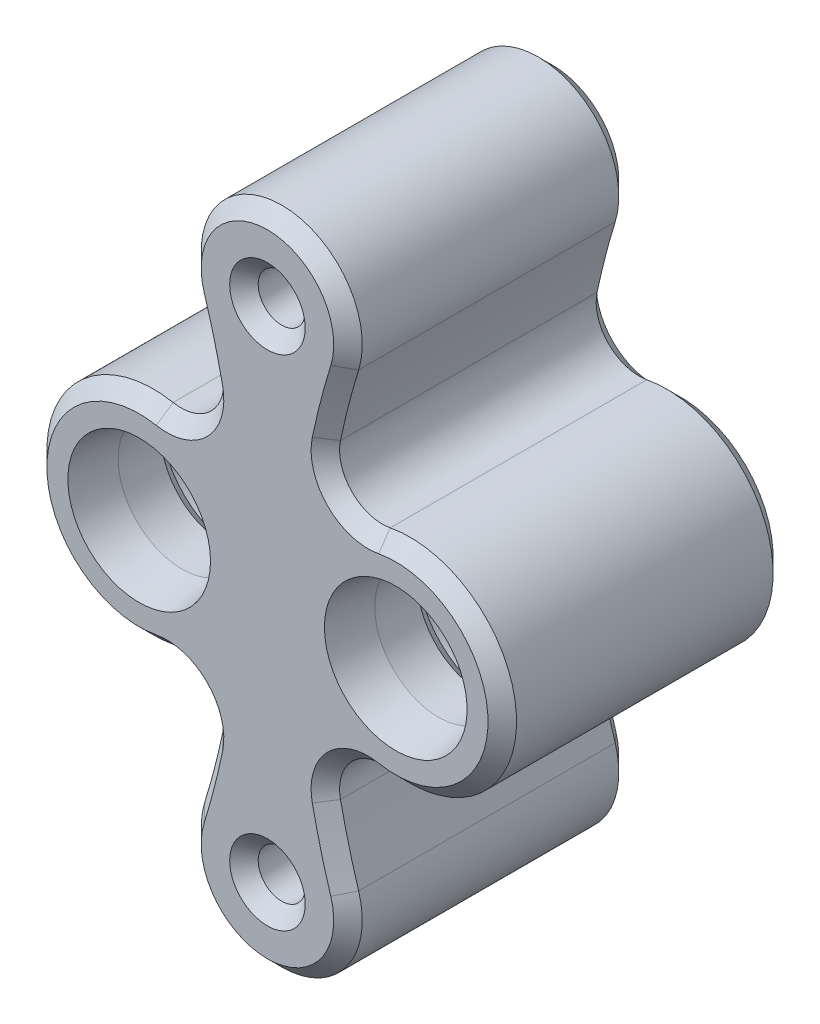
from build123d import *
from OCP.BRepFilletAPI import BRepFilletAPI_MakeChamfer

# Parameters (mm, degrees)
SKETCH1_R               = 1.65
SKETCH1_R_2             = 4.475
BOSS_EXTRUDE1_DEPTH     = 20
CHAMFER1_SIZE           = 1
CHAMFER2_SIZE           = 3
CHAMFER2_SIZE2          = 0.528980942
CUT_EXTRUDE1_DEPTH      = 3
CUT_EXTRUDE1_DEPTH_BACK = 3
SKETCH5_R               = 5.475
CHAMFER3_SIZE           = 1


with BuildPart() as part:
    # Sketch1 → Boss-Extrude1 (new body)
    with BuildSketch(Plane.XY):
        with BuildLine():
            ThreePointArc((5.396692576, -1.672784876), (0, 5.65), (-5.396692576, -1.672784876))
            ThreePointArc((-5.396692576, -1.672784876), (-4.701973782, -4.118237099), (-4.124302136, -6.593952399))
            ThreePointArc((-4.124302136, -6.593952399), (-4.919523181, -9.306745557), (-7.616470373, -10.154152821))
            ThreePointArc((-7.616470373, -10.154152821), (-16.475, -17.5), (-7.616470373, -24.845847179))
            ThreePointArc((-7.616470373, -24.845847179), (-4.919523181, -25.693254443), (-4.124302136, -28.406047601))
            ThreePointArc((-4.124302136, -28.406047601), (-4.701973782, -30.881762901), (-5.396692576, -33.327215124))
            ThreePointArc((-5.396692576, -33.327215124), (0, -40.65), (5.396692576, -33.327215124))
            ThreePointArc((5.396692576, -33.327215124), (4.701973782, -30.881762901), (4.124302136, -28.406047601))
            ThreePointArc((4.124302136, -28.406047601), (4.919523181, -25.693254443), (7.616470373, -24.845847179))
            ThreePointArc((7.616470373, -24.845847179), (16.475, -17.5), (7.616470373, -10.154152821))
            ThreePointArc((7.616470373, -10.154152821), (4.919523181, -9.306745557), (4.124302136, -6.593952399))
            ThreePointArc((4.124302136, -6.593952399), (4.701973782, -4.118237099), (5.396692576, -1.672784876))
        make_face()
        Circle(SKETCH1_R, mode=Mode.SUBTRACT)
        with Locations((0, -35)):
            Circle(SKETCH1_R, mode=Mode.SUBTRACT)
        with Locations((9, -17.5)):
            Circle(SKETCH1_R_2, mode=Mode.SUBTRACT)
        with Locations((-9, -17.5)):
            Circle(SKETCH1_R_2, mode=Mode.SUBTRACT)
    extrude(amount=BOSS_EXTRUDE1_DEPTH)

    # Chamfer1
    chamfer1_edges = [part.edges().sort_by_distance(p)[0] for p in [
        (0, -40.65, 0),
        (-4.701973782, -30.881762901, 0),
        (16.475, -17.5, 20),
        (-4.919523181, -25.693254443, 0),
        (-16.475, -17.5, 0),
        (-4.919523181, -9.306745557, 0),
        (-4.701973782, -4.118237099, 0),
        (0, 5.65, 0),
        (4.701973782, -4.118237099, 0),
        (4.919523181, -9.306745557, 0),
        (16.475, -17.5, 0),
        (4.919523181, -25.693254443, 0),
        (4.701973782, -30.881762901, 0),
        (4.919523181, -9.306745557, 20),
        (4.701973782, -4.118237099, 20),
        (0, 5.65, 20),
        (-4.701973782, -4.118237099, 20),
        (-1.65, 0, 0),
        (-1.65, 0, 20),
        (-4.919523181, -9.306745557, 20),
        (-1.65, -35, 0),
        (-1.65, -35, 20),
        (-16.475, -17.5, 20),
        (-4.919523181, -25.693254443, 20),
        (-4.701973782, -30.881762901, 20),
        (0, -40.65, 20),
        (4.701973782, -30.881762901, 20),
        (4.919523181, -25.693254443, 20),
    ]]
    chamfer(chamfer1_edges, length=CHAMFER1_SIZE)

    # Chamfer2: one chamfer whose edges measure the first distance from different faces: ONE call of the kernel's chamfer builder (chamfer() names one face for all edges)
    chamfer2_edges_1 = [part.edges().sort_by_distance(p)[0] for p in [
        (4.525, -17.5, 0),
        (4.525, -17.5, 20),
    ]]
    chamfer2_side_1 = [part.faces().sort_by_distance(p)[0] for p in [
        (4.525, -17.5, 10),
    ]]
    chamfer2_edges_2 = [part.edges().sort_by_distance(p)[0] for p in [
        (-13.475, -17.5, 0),
        (-13.475, -17.5, 20),
    ]]
    chamfer2_side_2 = [part.faces().sort_by_distance(p)[0] for p in [
        (-13.475, -17.5, 10),
    ]]
    chamfer2 = BRepFilletAPI_MakeChamfer(part.part.solid().wrapped)
    for e in chamfer2_edges_1:
        chamfer2.Add(CHAMFER2_SIZE, CHAMFER2_SIZE2, e.wrapped, chamfer2_side_1[0].wrapped)  # the first distance lies on this face
    for e in chamfer2_edges_2:
        chamfer2.Add(CHAMFER2_SIZE, CHAMFER2_SIZE2, e.wrapped, chamfer2_side_2[0].wrapped)  # the first distance lies on this face
    add(Compound.cast(chamfer2.Shape()), mode=Mode.REPLACE)

    # Sketch5 → Cut-Extrude1 (cut, two sides: drawn at the far end of the back side and taken through both)
    with BuildSketch(Plane.XY.offset(10).offset(-CUT_EXTRUDE1_DEPTH_BACK)):
        with Locations((-9, -17.5)):
            Circle(SKETCH5_R)
        with Locations((9, -17.5)):
            Circle(SKETCH5_R)
    extrude(amount=CUT_EXTRUDE1_DEPTH + CUT_EXTRUDE1_DEPTH_BACK, mode=Mode.SUBTRACT)

    # Chamfer3
    chamfer3_edges = [part.edges().sort_by_distance(p)[0] for p in [
        (-13.475, -17.5, 13),
        (-13.475, -17.5, 7),
        (4.525, -17.5, 13),
        (4.525, -17.5, 7),
    ]]
    chamfer(chamfer3_edges, length=CHAMFER3_SIZE - 0.0001)  # a hair under: the kernel refuses the full size


solid = part.part
